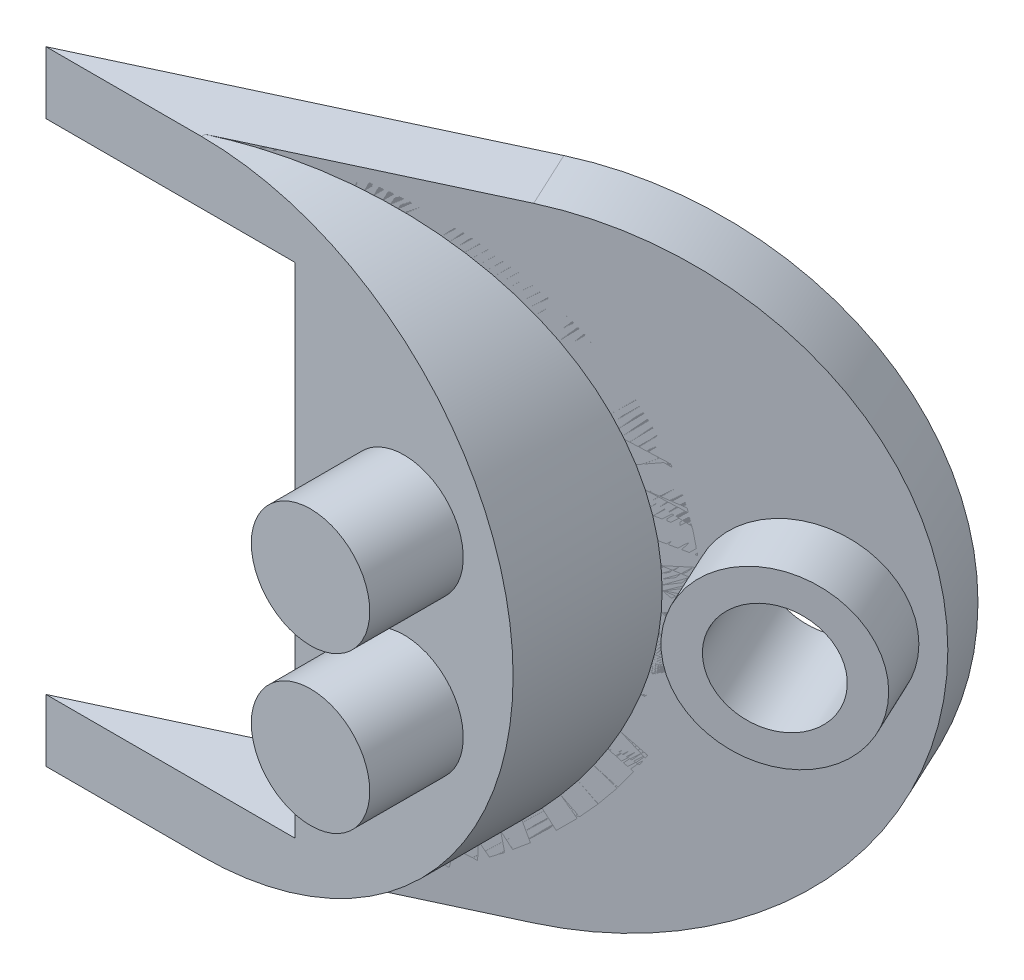
from build123d import *

# Parameters (mm, degrees)
BOSS_EXTRUDE1_DEPTH     = 20
CUT_EXTRUDE1_START      = -20
CUT_EXTRUDE1_DEPTH      = 20
SKETCH4_R               = 1.9
BOSS_EXTRUDE2_DEPTH     = 3
BOSS_EXTRUDE3_DEPTH     = 2
INTERSECT3_START        = -3.545087111
INTERSECT3_DEPTH        = 2
CUT_EXTRUDE3_DEPTH      = 12
CUT_EXTRUDE3_DEPTH_BACK = 42.091890171
SKETCH9_R               = 1.75
BOSS_EXTRUDE4_START     = 2
SKETCH10_R              = 2.75
SKETCH10_R_2            = 1.75
BOSS_EXTRUDE4_DEPTH     = 2


with BuildPart() as part:
    # Sketch1 → Boss-Extrude1 (new body)
    with BuildSketch(Plane(origin=(0, 0, -0.380808332), x_dir=(-1, 0, 0), z_dir=(0, 0, -1))):
        with BuildLine():
            Line((7.571744633, 37.567534319), (2.583293076, 37.567534319))
            ThreePointArc((2.583293076, 37.567534319), (-7.416706924, 27.567534319), (2.583293076, 17.567534319))
            Line((2.583293076, 17.567534319), (7.571744633, 17.567534319))
            Line((7.571744633, 17.567534319), (7.571744633, 19.567534319))
            Line((7.571744633, 19.567534319), (-0.416706924, 19.567534319))
            Line((-0.416706924, 19.567534319), (-0.416706924, 35.567534319))
            Line((-0.416706924, 35.567534319), (7.571744633, 35.567534319))
            Line((7.571744633, 35.567534319), (7.571744633, 37.567534319))
        make_face()
    extrude(amount=BOSS_EXTRUDE1_DEPTH)

    # Cut-Extrude1: read off the stored shape, not the designer's step
    # Cut-Extrude1 outline → Cut-Extrude1 (cut)
    with BuildSketch(Plane.XZ.offset(-17.567534319).offset(CUT_EXTRUDE1_START)):
        Polygon((-7.571744633, -0.380808332), (-7.571744633, -20.380808332), (7.416706924, -20.380808332), (7.416706924, -7.370038076), align=None)
    extrude(amount=CUT_EXTRUDE1_DEPTH, mode=Mode.SUBTRACT)

    # Sketch4 → Boss-Extrude2 (add)
    with BuildSketch(Plane.XY.offset(-0.380808332)):
        with Locations(Location((3.916706924, 30.067534319, 0), (0, 0, 180))):
            Circle(SKETCH4_R)
        with Locations(Location((3.916706924, 25.067534319, 0), (0, 0, 180))):
            Circle(SKETCH4_R)
    extrude(amount=BOSS_EXTRUDE2_DEPTH)



with BuildPart() as body_2:
    # Sketch5 → Boss-Extrude3 (new body)
    with BuildSketch(Plane(origin=(-1.498218553, 0, -3.212940055), x_dir=(-0.9063077870366496, 0, 0.42261826174070033), z_dir=(-0.4226182617407003, 0, -0.9063077870366495))):
        with BuildLine():
            Line((-5.80275273, 35.29745693), (-5.80275273, 37.567534319))
            ThreePointArc((-5.80275273, 37.567534319), (-15.80275273, 27.567534319), (-5.80275273, 17.567534319))
            Line((-5.80275273, 17.567534319), (-5.80275273, 19.837611709))
            add(Edge.make_bspline(
                [(-5.80275273, 35.29745693), (-9.83653192, 32.297006625), (-9.83653192, 27.567534319), (-9.83653192, 22.838062014), (-5.80275273, 19.837611709)],
                knots=[2.263071394, 2.263071394, 2.263071394, 3.141592654, 3.141592654, 4.020113913, 4.020113913, 4.020113913], degree=2, weights=[0.855612192, 0.836189508, 1, 0.836189508, 0.855612192]))
        make_face()
        with BuildLine():
            Line((-5.80275273, 19.837611709), (-5.80275273, 17.567534319))
            Line((-5.80275273, 17.567534319), (1.19724727, 17.567534319))
            add(Edge.make_bspline(
                [(-5.80275273, 19.837611709), (-2.750880511, 17.567534319), (1.19724727, 17.567534319)],
                knots=[4.020113913, 4.020113913, 4.020113913, 4.71238898, 4.71238898, 4.71238898], degree=2, weights=[0.855612192, 0.870917273, 1]))
        make_face()
        with BuildLine():
            Line((1.19724727, 37.567534319), (-5.80275273, 37.567534319))
            Line((-5.80275273, 37.567534319), (-5.80275273, 35.29745693))
            add(Edge.make_bspline(
                [(1.19724727, 37.567534319), (-2.750880511, 37.567534319), (-5.80275273, 35.29745693)],
                knots=[1.570796327, 1.570796327, 1.570796327, 2.263071394, 2.263071394, 2.263071394], degree=2, weights=[1, 0.870917273, 0.855612192]))
        make_face()
    extrude(amount=-BOSS_EXTRUDE3_DEPTH)


with BuildPart() as part_1:
    add(part.part)

    add(body_2.part)  # Intersect3 merges body 2
    # Intersect3: read off the stored shape, not the designer's step
    # Intersect3 outline → Intersect3 (add)
    with BuildSketch(Plane(origin=(0, 0, 0), x_dir=(0.9063077870366488, 0, -0.42261826174070194), z_dir=(0.4226182617407019, 0, 0.9063077870366488)).offset(INTERSECT3_START)):
        with BuildLine():
            ThreePointArc((5.80275273, 17.567534319), (15.80275273, 27.567534319), (5.80275273, 37.567534319))
            Line((5.80275273, 37.567534319), (-2.129862586, 37.567534319))
            add(Edge.make_bspline(
                [(-2.129862586, 17.567534319), (8.903916604, 17.567534319), (8.903916604, 27.567534319), (8.903916604, 37.567534319), (-2.129862586, 37.567534319)],
                knots=[1.570796327, 1.570796327, 1.570796327, 3.141592654, 3.141592654, 4.71238898, 4.71238898, 4.71238898], degree=2, weights=[1, 0.707106781, 1, 0.707106781, 1]))
            Line((-2.129862586, 17.567534319), (5.80275273, 17.567534319))
        make_face()
    extrude(amount=INTERSECT3_DEPTH)

    # Sketch9 → Cut-Extrude3 (cut, two sides: drawn at the far end of the back side and taken through both)
    with BuildSketch(Plane(origin=(-0.652982029, 0, -1.400324481), x_dir=(0.9063077870366496, 0, -0.4226182617407002), z_dir=(0.4226182617407003, 0, 0.9063077870366497)).offset(-CUT_EXTRUDE3_DEPTH_BACK)):
        with Locations(Location((12.353334667, 27.567534319, 0), (0, 0, 180))):
            Circle(SKETCH9_R)
    extrude(amount=CUT_EXTRUDE3_DEPTH + CUT_EXTRUDE3_DEPTH_BACK, mode=Mode.SUBTRACT)

    # Sketch10 → Boss-Extrude4 (add)
    with BuildSketch(Plane(origin=(-0.652982029, 0, -1.400324481), x_dir=(0.9063077870366488, 0, -0.4226182617407019), z_dir=(0.4226182617407019, 0, 0.9063077870366488)).offset(BOSS_EXTRUDE4_START)):
        with Locations((12.353334667, 27.567534319)):
            Circle(SKETCH10_R)
        with Locations(Location((12.353334667, 27.567534319, 0), (0, 0, 180))):
            Circle(SKETCH10_R_2, mode=Mode.SUBTRACT)
    extrude(amount=-BOSS_EXTRUDE4_DEPTH)


solid = part_1.part
